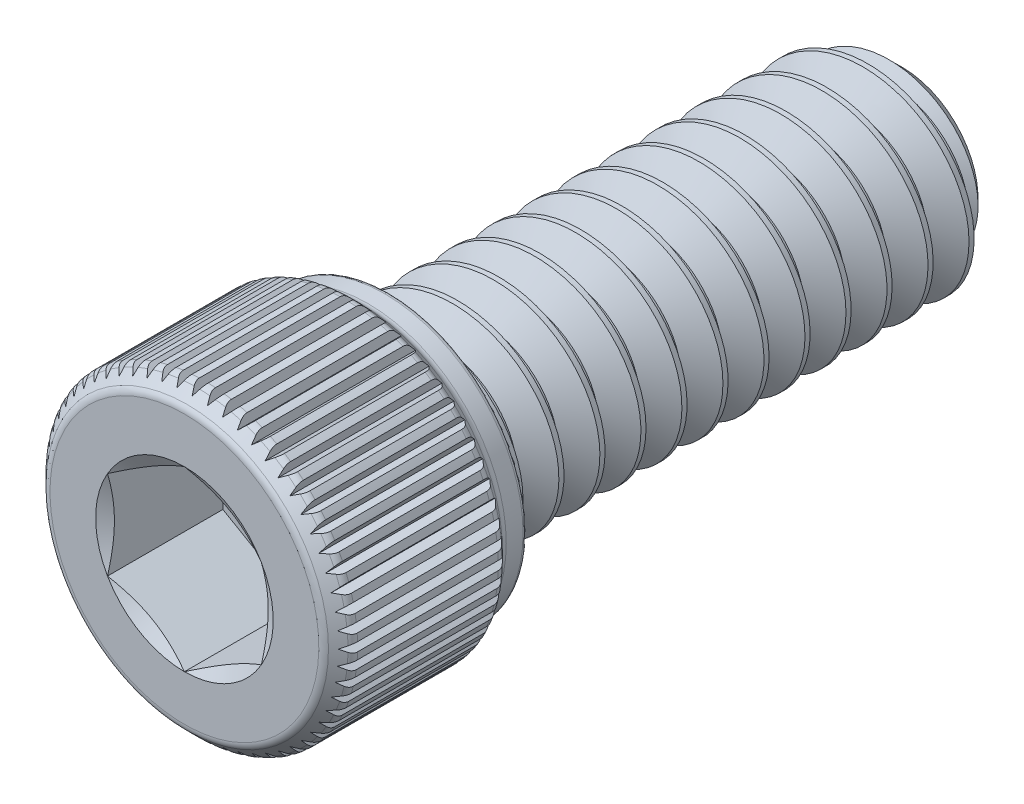
from build123d import *

# Parameters (mm, degrees)
CUT_EXTRUDE1_DEPTH = 3.571875
CUT_SWEEP1_PITCH   = 1.27
CUT_EXTRUDE3_START = -5.318125
CUT_EXTRUDE3_DEPTH = 5.08
CIRPATTERN1_COUNT  = 60


with BuildPart() as part:
    # Sketch2 → Revolve1 (revolve)
    with BuildSketch(Plane(origin=(0, 0, 0), x_dir=(0, 0, -1), z_dir=(1, 0, 0))):
        with BuildLine():
            Line((11.1125, 2.350110803), (10.287610803, 3.175))
            Line((10.287610803, 3.175), (-4.7625, 3.175))
            Line((-4.7625, 3.175), (-4.7625, 4.137421875))
            ThreePointArc((-4.7625, 4.137421875), (-4.806090749, 4.242659251), (-4.911328125, 4.28625))
            Line((-4.911328125, 4.28625), (-5.432956744, 4.28625))
            ThreePointArc((-5.432956744, 4.28625), (-5.54686486, 4.308907733), (-5.643431497, 4.373431497))
            Line((-5.643431497, 4.373431497), (-5.945318503, 4.675318503))
            ThreePointArc((-5.945318503, 4.675318503), (-6.04188514, 4.739842267), (-6.155793256, 4.7625))
            Line((-6.155793256, 4.7625), (-10.512956744, 4.7625))
            ThreePointArc((-10.512956744, 4.7625), (-10.62686486, 4.739842267), (-10.723431497, 4.675318503))
            Line((-10.723431497, 4.675318503), (-11.025318503, 4.373431497))
            ThreePointArc((-11.025318503, 4.373431497), (-11.089842267, 4.27686486), (-11.1125, 4.162956744))
            Line((-11.1125, 4.162956744), (-11.1125, 0))
            Line((-11.1125, 0), (11.1125, 0))
            Line((11.1125, 0), (11.1125, 2.350110803))
        make_face()
    revolve(axis=Axis((0, 0, -11.1125), (0, 0, 1)))

    # Sketch4 → Cut-Extrude1 (cut)
    with BuildSketch(Plane.XY.offset(11.1125)):
        Polygon((0, 2.749630657), (-2.38125, 1.374815329), (-2.38125, -1.374815329), (0, -2.749630657), (2.38125, -1.374815329), (2.38125, 1.374815329), align=None)
    extrude(amount=-CUT_EXTRUDE1_DEPTH, mode=Mode.SUBTRACT)

    # Cut-Extrude2: read off the stored shape, not the designer's step
    # Cut-Extrude2: loft between two sections, ruled curve by curve
    cut_extrude2_from = [
        Edge.make_three_point_arc((4e-09, 2.380971631, 10.899654612), (-1.190485814, 2.061981919, 10.899654612), (-2.061981918, 1.190485816, 10.899654612)),
        Edge.make_line((-2.061981918, 1.190485816, 10.899654612), (4e-09, 2.380971631, 10.899654612)),
    ]
    cut_extrude2_to = [
        Edge.make_three_point_arc((4e-09, 2.749630657, 11.1125), (-1.374815327, 2.381250001, 11.1125), (-2.38125, 1.374815329, 11.1125)),
        Edge.make_line((-2.38125, 1.374815329, 11.1125), (4e-09, 2.749630657, 11.1125)),
    ]
    cut_extrude2 = Solid(Shell([*[Face.make_surface_from_curves(cut_extrude2_from[k], cut_extrude2_to[k]) for k in range(2)], Face(Wire(cut_extrude2_from)), Face(Wire(cut_extrude2_to))]))
    add(cut_extrude2, mode=Mode.SUBTRACT)

    # Cut-Extrude2 2: loft between two sections, ruled curve by curve
    cut_extrude2_2_from = [
        Edge.make_three_point_arc((-2.061980129, 1.190485048, 10.899653496), (-2.380969698, 1.7e-08, 10.899653496), (-2.061980146, -1.190485019, 10.899653496)),
        Edge.make_line((-2.061980146, -1.190485019, 10.899653496), (-2.061980129, 1.190485048, 10.899653496)),
    ]
    cut_extrude2_2_to = [
        Edge.make_three_point_arc((-2.381249867, 1.374815558, 11.1125), (-2.749630657, 1.9e-08, 11.1125), (-2.381249887, -1.374815525, 11.1125)),
        Edge.make_line((-2.381249887, -1.374815525, 11.1125), (-2.381249867, 1.374815558, 11.1125)),
    ]
    cut_extrude2_2 = Solid(Shell([*[Face.make_surface_from_curves(cut_extrude2_2_from[k], cut_extrude2_2_to[k]) for k in range(2)], Face(Wire(cut_extrude2_2_from)), Face(Wire(cut_extrude2_2_to))]))
    add(cut_extrude2_2, mode=Mode.SUBTRACT)

    # Cut-Extrude2 3: loft between two sections, ruled curve by curve
    cut_extrude2_3_from = [
        Edge.make_three_point_arc((-2.06198192, -1.190485812, 10.899654612), (-1.190485817, -2.061981917, 10.899654612), (0, -2.380971631, 10.899654612)),
        Edge.make_line((0, -2.380971631, 10.899654612), (-2.06198192, -1.190485812, 10.899654612)),
    ]
    cut_extrude2_3_to = [
        Edge.make_three_point_arc((-2.381250003, -1.374815325, 11.1125), (-1.374815331, -2.381249999, 11.1125), (0, -2.749630657, 11.1125)),
        Edge.make_line((0, -2.749630657, 11.1125), (-2.381250003, -1.374815325, 11.1125)),
    ]
    cut_extrude2_3 = Solid(Shell([*[Face.make_surface_from_curves(cut_extrude2_3_from[k], cut_extrude2_3_to[k]) for k in range(2)], Face(Wire(cut_extrude2_3_from)), Face(Wire(cut_extrude2_3_to))]))
    add(cut_extrude2_3, mode=Mode.SUBTRACT)

    # Cut-Extrude2 4: loft between two sections, ruled curve by curve
    cut_extrude2_4_from = [
        Edge.make_three_point_arc((-4e-09, -2.380971631, 10.899654612), (1.190485814, -2.061981919, 10.899654612), (2.061981918, -1.190485816, 10.899654612)),
        Edge.make_line((2.061981918, -1.190485816, 10.899654612), (-4e-09, -2.380971631, 10.899654612)),
    ]
    cut_extrude2_4_to = [
        Edge.make_three_point_arc((-4e-09, -2.749630657, 11.1125), (1.374815327, -2.381250001, 11.1125), (2.38125, -1.374815329, 11.1125)),
        Edge.make_line((2.38125, -1.374815329, 11.1125), (-4e-09, -2.749630657, 11.1125)),
    ]
    cut_extrude2_4 = Solid(Shell([*[Face.make_surface_from_curves(cut_extrude2_4_from[k], cut_extrude2_4_to[k]) for k in range(2)], Face(Wire(cut_extrude2_4_from)), Face(Wire(cut_extrude2_4_to))]))
    add(cut_extrude2_4, mode=Mode.SUBTRACT)

    # Cut-Extrude2 5: loft between two sections, ruled curve by curve
    cut_extrude2_5_from = [
        Edge.make_three_point_arc((2.061980146, -1.190485019, 10.899653496), (2.380969698, 1.7e-08, 10.899653496), (2.061980129, 1.190485048, 10.899653496)),
        Edge.make_line((2.061980129, 1.190485048, 10.899653496), (2.061980146, -1.190485019, 10.899653496)),
    ]
    cut_extrude2_5_to = [
        Edge.make_three_point_arc((2.381249887, -1.374815525, 11.1125), (2.749630657, 1.9e-08, 11.1125), (2.381249867, 1.374815558, 11.1125)),
        Edge.make_line((2.381249867, 1.374815558, 11.1125), (2.381249887, -1.374815525, 11.1125)),
    ]
    cut_extrude2_5 = Solid(Shell([*[Face.make_surface_from_curves(cut_extrude2_5_from[k], cut_extrude2_5_to[k]) for k in range(2)], Face(Wire(cut_extrude2_5_from)), Face(Wire(cut_extrude2_5_to))]))
    add(cut_extrude2_5, mode=Mode.SUBTRACT)

    # Cut-Extrude2 6: loft between two sections, ruled curve by curve
    cut_extrude2_6_from = [
        Edge.make_three_point_arc((2.06198192, 1.190485812, 10.899654612), (1.190485817, 2.061981917, 10.899654612), (0, 2.380971631, 10.899654612)),
        Edge.make_line((0, 2.380971631, 10.899654612), (2.06198192, 1.190485812, 10.899654612)),
    ]
    cut_extrude2_6_to = [
        Edge.make_three_point_arc((2.381250003, 1.374815325, 11.1125), (1.374815331, 2.381249999, 11.1125), (0, 2.749630657, 11.1125)),
        Edge.make_line((0, 2.749630657, 11.1125), (2.381250003, 1.374815325, 11.1125)),
    ]
    cut_extrude2_6 = Solid(Shell([*[Face.make_surface_from_curves(cut_extrude2_6_from[k], cut_extrude2_6_to[k]) for k in range(2)], Face(Wire(cut_extrude2_6_from)), Face(Wire(cut_extrude2_6_to))]))
    add(cut_extrude2_6, mode=Mode.SUBTRACT)

    # Cut-Sweep1: arcs per turn and ends read off the stored shape
    # Cut-Sweep1: the profile of Sketch7 profile screwed along a right-hand helix through 12.75 turns, 8 arcs to a turn; built about Z, then put on its axis
    cut_sweep1_z = Axis((0, 0, 0), (0, 0, 1))
    cut_sweep1_corners = [(3.1753, 0, 0.000173205), (3.1753, 0, -1.111423205), (2.350110803, 0, -0.635), (2.350110803, 0, -0.47625)]
    with BuildLine(mode=Mode.PRIVATE) as cut_sweep1_profile:
        Line(cut_sweep1_corners[0], cut_sweep1_corners[1])
        Line(cut_sweep1_corners[1], cut_sweep1_corners[2])
        Line(cut_sweep1_corners[2], cut_sweep1_corners[3])
        Line(cut_sweep1_corners[3], cut_sweep1_corners[0])
    cut_sweep1_cap = Face(cut_sweep1_profile.wire())
    cut_sweep1_turn_angles = [0, 22.5, 45, 67.5, 90, 112.5, 135, 157.5, 180, 202.5, 225, 247.5, 270, 292.5, 315, 337.5, 360]
    cut_sweep1_turn_weights = [1, 0.9238795325112867, 1, 0.9238795325112867, 1, 0.9238795325112867, 1, 0.9238795325112867, 1, 0.9238795325112867, 1, 0.9238795325112867, 1, 0.9238795325112867, 1, 0.9238795325112867, 1]
    cut_sweep1_turn_rails = [Edge.make_bspline([Vector(p[0], p[1], 0).rotate(cut_sweep1_z, cut_sweep1_turn_angles[k]) / cut_sweep1_turn_weights[k] + Vector(0, 0, p[2] + CUT_SWEEP1_PITCH * cut_sweep1_turn_angles[k] / 360) for k in range(17)], [0, 0, 0, 1, 1, 2, 2, 3, 3, 4, 4, 5, 5, 6, 6, 7, 7, 8, 8, 8], 2, cut_sweep1_turn_weights) for p in cut_sweep1_corners]
    cut_sweep1_turn_sides = [Face.make_surface_from_curves(cut_sweep1_turn_rails[p[0]], cut_sweep1_turn_rails[p[1]]) for p in [(0, 1), (1, 2), (2, 3), (3, 0)]]
    cut_sweep1_last_angles = [4320, 4342.5, 4365, 4387.5, 4410, 4432.5, 4455, 4477.5, 4500, 4522.5, 4545, 4567.5, 4590]
    cut_sweep1_last_weights = [1, 0.9238795325112867, 1, 0.9238795325112867, 1, 0.9238795325112867, 1, 0.9238795325112867, 1, 0.9238795325112867, 1, 0.9238795325113202, 1]
    cut_sweep1_last_rails = [Edge.make_bspline([Vector(p[0], p[1], 0).rotate(cut_sweep1_z, cut_sweep1_last_angles[k]) / cut_sweep1_last_weights[k] + Vector(0, 0, p[2] + CUT_SWEEP1_PITCH * cut_sweep1_last_angles[k] / 360) for k in range(13)], [0, 0, 0, 1, 1, 2, 2, 3, 3, 4, 4, 5, 5, 6, 6, 6], 2, cut_sweep1_last_weights) for p in cut_sweep1_corners]
    cut_sweep1_last_sides = [Face.make_surface_from_curves(cut_sweep1_last_rails[p[0]], cut_sweep1_last_rails[p[1]]) for p in [(0, 1), (1, 2), (2, 3), (3, 0)]]
    cut_sweep1 = Plane(origin=(0, 0, -11.1125), x_dir=(0, 1, 0), z_dir=(0, 0, 1)) * Solid(Shell([*[p.moved(Location((0, 0, CUT_SWEEP1_PITCH * i))) for i in range(12) for p in cut_sweep1_turn_sides], *cut_sweep1_last_sides, cut_sweep1_cap, cut_sweep1_cap.rotate(cut_sweep1_z, 4590).moved(Location((0, 0, CUT_SWEEP1_PITCH * 4590 / 360)))]))
    add(cut_sweep1, mode=Mode.SUBTRACT)

    # Sketch8 → Revolve2 (revolve)
    with BuildSketch(Plane(origin=(0, 0, 0), x_dir=(0, 0, -1), z_dir=(1, 0, 0))):
        Polygon((-6.155793256, 0), (-6.155793256, 3.243740766), (-4.1275, 3.243740766), (-2.254725395, 0), align=None)
    revolve(axis=Axis((0, 0, 2.254725395), (0, 0, 1)))

    # Sketch6 → Cut-Extrude3 (cut)
    with BuildSketch(Plane.XY.offset(11.1125).offset(CUT_EXTRUDE3_START)):
        Polygon((-0.229135888, 4.92125), (0, 4.524375), (0.229135888, 4.92125), align=None)
    cut_extrude3 = extrude(amount=CUT_EXTRUDE3_DEPTH, mode=Mode.SUBTRACT)

    # CirPattern1: Cut-Extrude3 ×60 about axis
    cirpattern1_axis = Axis((0, 0, 0), (0, 0, 1))
    for i in range(1, CIRPATTERN1_COUNT):
        add(cut_extrude3.rotate(cirpattern1_axis, i * 360 / CIRPATTERN1_COUNT), mode=Mode.SUBTRACT)


solid = part.part
